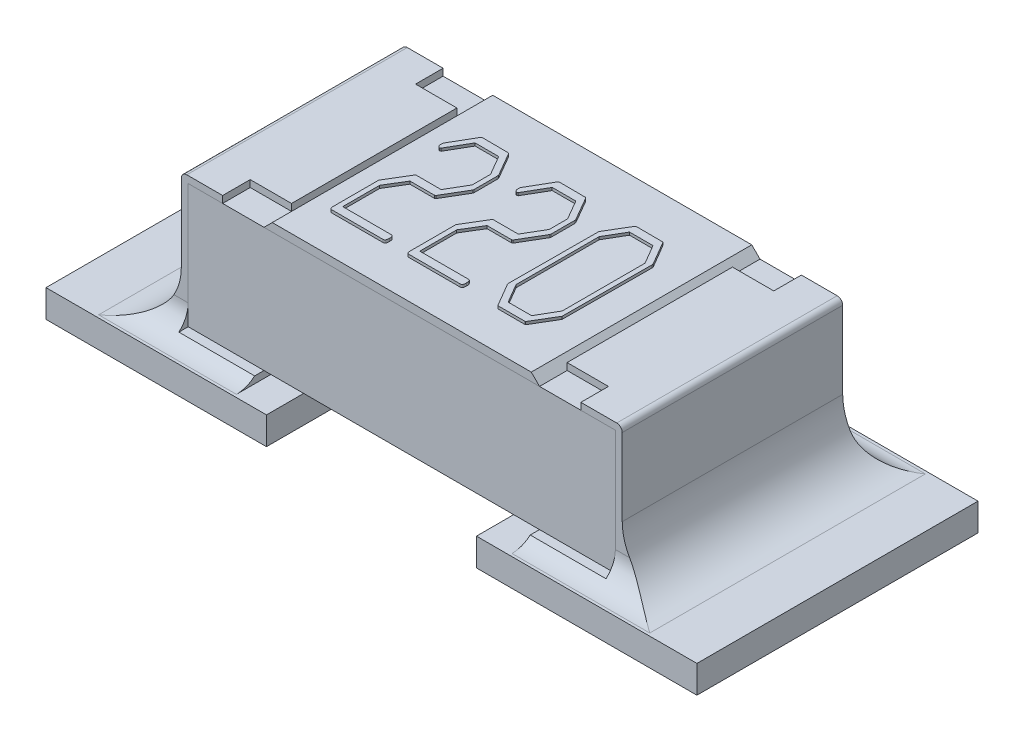
from build123d import *

# Parameters (mm, degrees)
SKETCH1_W             = 0.8
SKETCH1_H             = 0.45
BOSS_EXTRUDE1_DEPTH   = 0.775
BOSS_EXTRUDE2_DEPTH   = 0.4
BOSS_EXTRUDE2_2_DEPTH = 0.4
SKETCH3_W             = 0.15
SKETCH3_H             = 0.1
CUT_EXTRUDE1_DEPTH    = 0.025
BOSS_EXTRUDE3_DEPTH   = 0.4
BOSS_EXTRUDE4_DEPTH   = 0.01
SKETCH7_W             = 0.8
SKETCH7_H             = 1.02
BOSS_EXTRUDE5_DEPTH   = 0.1
FILLET3_R             = 0.2
FILLET4_R             = 0.2
FILLET5_R             = 0.1
FILLET6_R             = 0.1


with BuildPart() as part:
    # Sketch1 → Boss-Extrude1 (new, symmetric)
    with BuildSketch(Plane(origin=(0, 0, 0), x_dir=(0, 0, -1), z_dir=(1, 0, 0))):
        with Locations((0, 0.35)):
            Rectangle(SKETCH1_W, SKETCH1_H)
    extrude(amount=BOSS_EXTRUDE1_DEPTH, both=True)


with BuildPart() as body_2:
    # Sketch2 → Boss-Extrude2 (new, symmetric)
    with BuildSketch(Plane.XY):
        with BuildLine():
            Line((-0.5, 0.6), (-0.78, 0.6))
            ThreePointArc((-0.78, 0.6), (-0.794142136, 0.594142136), (-0.8, 0.58))
            Line((-0.8, 0.58), (-0.8, 0.1))
            Line((-0.8, 0.1), (-0.5, 0.1))
            Line((-0.5, 0.1), (-0.5, 0.125))
            Line((-0.5, 0.125), (-0.775, 0.125))
            Line((-0.775, 0.125), (-0.775, 0.575))
            Line((-0.775, 0.575), (-0.5, 0.575))
            Line((-0.5, 0.575), (-0.5, 0.6))
        make_face()
    extrude(amount=BOSS_EXTRUDE2_DEPTH, both=True)


with BuildPart() as body_3:
    # Sketch2 → Boss-Extrude2 2 (new, symmetric)
    with BuildSketch(Plane.XY):
        with BuildLine():
            Line((0.5, 0.575), (0.5, 0.6))
            Line((0.5, 0.6), (0.78, 0.6))
            ThreePointArc((0.78, 0.6), (0.794142136, 0.594142136), (0.8, 0.58))
            Line((0.8, 0.58), (0.8, 0.1))
            Line((0.8, 0.1), (0.5, 0.1))
            Line((0.5, 0.1), (0.5, 0.125))
            Line((0.5, 0.125), (0.775, 0.125))
            Line((0.775, 0.125), (0.775, 0.575))
            Line((0.775, 0.575), (0.5, 0.575))
        make_face()
    extrude(amount=BOSS_EXTRUDE2_2_DEPTH, both=True)


with BuildPart() as cut_extrude1_tool:
    # Sketch3 → Cut-Extrude1 (new body)
    with BuildSketch(Plane(origin=(0, 0.6, 0), x_dir=(1, 0, 0), z_dir=(0, 1, 0))):
        with Locations((-0.575, 0.35)):
            Rectangle(SKETCH3_W, SKETCH3_H)
        with Locations((-0.575, -0.35)):
            Rectangle(SKETCH3_W, SKETCH3_H)
        with Locations((0.575, -0.35)):
            Rectangle(SKETCH3_W, SKETCH3_H)
        with Locations((0.575, 0.35)):
            Rectangle(SKETCH3_W, SKETCH3_H)
    extrude(amount=-CUT_EXTRUDE1_DEPTH)


with BuildPart() as body_2_1:
    add(body_2.part)

    # Cut-Extrude1: cut by cut_extrude1_tool
    add(cut_extrude1_tool.part, mode=Mode.SUBTRACT)



with BuildPart() as body_3_1:
    add(body_3.part)

    # Cut-Extrude1: cut by cut_extrude1_tool
    add(cut_extrude1_tool.part, mode=Mode.SUBTRACT)


with BuildPart() as body_4:
    # Sketch4 → Boss-Extrude3 (new, symmetric)
    with BuildSketch(Plane.XY):
        Polygon((-0.5, 0.575), (0.5, 0.575), (0.47, 0.605), (-0.47, 0.605), align=None)
    extrude(amount=BOSS_EXTRUDE3_DEPTH, both=True)

    # Sketch6 → Boss-Extrude4 (add)
    # profile 1 of 3: a face of its own
    with BuildSketch(Plane(origin=(0, 0.605, 0), x_dir=(1, 0, 0), z_dir=(0, 1, 0))):
        with BuildLine():
            Line((-0.246912202, 0.234002976), (-0.198456101, 0.150204613))
            Line((-0.198456101, 0.150204613), (-0.197619048, 0.143973214))
            Line((-0.197619048, 0.143973214), (-0.197619048, 0.060918899))
            Line((-0.197619048, 0.060918899), (-0.198456101, 0.056082589))
            Line((-0.198456101, 0.056082589), (-0.247935268, -0.027715774))
            Line((-0.247935268, -0.027715774), (-0.2515625, -0.029761905))
            Line((-0.2515625, -0.029761905), (-0.340569196, -0.029761905))
            Line((-0.340569196, -0.029761905), (-0.382142857, -0.09812128))
            Line((-0.382142857, -0.09812128), (-0.382142857, -0.232142857))
            Line((-0.382142857, -0.232142857), (-0.204036458, -0.232142857))
            add(Edge.make_bspline(
                [(-0.204036458, -0.232142857), (-0.203042924, -0.232556276), (-0.200938585, -0.233431911), (-0.19880848, -0.236818481), (-0.19776471, -0.241464864), (-0.197671246, -0.245031762), (-0.197619048, -0.24702381)],
                knots=[0, 0, 0, 0, 0.727922013, 1.541763566, 2.627120282, 4, 4, 4, 4], degree=3))
            add(Edge.make_bspline(
                [(-0.197619048, -0.24702381), (-0.19766219, -0.248986973), (-0.197742135, -0.252624852), (-0.198833276, -0.256848985), (-0.200171796, -0.259656481), (-0.201882099, -0.261012244), (-0.20404098, -0.26175373), (-0.20561119, -0.261851985), (-0.206454613, -0.261904762)],
                knots=[0, 0, 0, 0, 1.783226064, 3.304443306, 3.949222629, 4.571326795, 5.232602427, 6, 6, 6, 6], degree=3))
            Line((-0.206454613, -0.261904762), (-0.394791667, -0.261904762))
            add(Edge.make_bspline(
                [(-0.394791667, -0.261904762), (-0.395997862, -0.260801207), (-0.398600433, -0.2584201), (-0.399511291, -0.254998187), (-0.4, -0.253162202)],
                knots=[0, 0, 0, 0, 0.926925341, 2, 2, 2, 2], degree=3))
            Line((-0.4, -0.253162202), (-0.4, -0.239676339))
            Line((-0.4, -0.239676339), (-0.4, -0.083519345))
            Line((-0.4, -0.083519345), (-0.350334821, -0.001302083))
            Line((-0.350334821, -0.001302083), (-0.348009673, 0))
            Line((-0.348009673, 0), (-0.257142857, 0))
            Line((-0.257142857, 0), (-0.21547619, 0.07077753))
            Line((-0.21547619, 0.07077753), (-0.21547619, 0.137555804))
            Line((-0.21547619, 0.137555804), (-0.256491815, 0.208333333))
            Line((-0.256491815, 0.208333333), (-0.342243304, 0.208333333))
            Line((-0.342243304, 0.208333333), (-0.387630208, 0.130208333))
            add(Edge.make_bspline(
                [(-0.387630208, 0.130208333), (-0.388357871, 0.129817639), (-0.389620694, 0.129139609), (-0.391031564, 0.128910385), (-0.391629464, 0.128813244)],
                knots=[0, 0, 0, 0, 1.152437574, 2, 2, 2, 2], degree=3))
            add(Edge.make_bspline(
                [(-0.391629464, 0.128813244), (-0.392807912, 0.129002619), (-0.39532525, 0.129407153), (-0.398122994, 0.132865271), (-0.399842375, 0.137855724), (-0.39994275, 0.14181055), (-0.4, 0.14406622)],
                knots=[0, 0, 0, 0, 0.723786097, 1.5461138, 2.600403721, 4, 4, 4, 4], degree=3))
            Line((-0.4, 0.14406622), (-0.399162946, 0.150297619))
            Line((-0.399162946, 0.150297619), (-0.349869792, 0.23530506))
            Line((-0.349869792, 0.23530506), (-0.346707589, 0.238095238))
            Line((-0.346707589, 0.238095238), (-0.249702381, 0.237444196))
            Line((-0.249702381, 0.237444196), (-0.246912202, 0.234002976))
        make_face()
    # profile 2 of 3: a face of its own
    with BuildSketch(Plane(origin=(0, 0.605, 0), x_dir=(1, 0, 0), z_dir=(0, 1, 0))):
        with BuildLine():
            Line((0.032849702, 0.234002976), (0.081305804, 0.150204613))
            Line((0.081305804, 0.150204613), (0.082142857, 0.143973214))
            Line((0.082142857, 0.143973214), (0.082142857, 0.060918899))
            Line((0.082142857, 0.060918899), (0.081305804, 0.056082589))
            Line((0.081305804, 0.056082589), (0.031826637, -0.027715774))
            Line((0.031826637, -0.027715774), (0.028199405, -0.029761905))
            Line((0.028199405, -0.029761905), (-0.060807292, -0.029761905))
            Line((-0.060807292, -0.029761905), (-0.102380952, -0.09812128))
            Line((-0.102380952, -0.09812128), (-0.102380952, -0.232142857))
            Line((-0.102380952, -0.232142857), (0.075725446, -0.232142857))
            add(Edge.make_bspline(
                [(0.075725446, -0.232142857), (0.076718981, -0.232556276), (0.07882332, -0.233431911), (0.080953425, -0.236818481), (0.081997194, -0.241464864), (0.082090659, -0.245031762), (0.082142857, -0.24702381)],
                knots=[0, 0, 0, 0, 0.727922013, 1.541763566, 2.627120282, 4, 4, 4, 4], degree=3))
            add(Edge.make_bspline(
                [(0.082142857, -0.24702381), (0.082099715, -0.248986973), (0.08201977, -0.252624852), (0.080928628, -0.256848985), (0.079590109, -0.259656481), (0.077879806, -0.261012244), (0.075720925, -0.26175373), (0.074150714, -0.261851985), (0.073307292, -0.261904762)],
                knots=[0, 0, 0, 0, 1.783226064, 3.304443306, 3.949222629, 4.571326795, 5.232602427, 6, 6, 6, 6], degree=3))
            Line((0.073307292, -0.261904762), (-0.115029762, -0.261904762))
            add(Edge.make_bspline(
                [(-0.115029762, -0.261904762), (-0.116235957, -0.260801207), (-0.118838528, -0.2584201), (-0.119749386, -0.254998187), (-0.120238095, -0.253162202)],
                knots=[0, 0, 0, 0, 0.926925341, 2, 2, 2, 2], degree=3))
            Line((-0.120238095, -0.253162202), (-0.120238095, -0.239676339))
            Line((-0.120238095, -0.239676339), (-0.120238095, -0.083519345))
            Line((-0.120238095, -0.083519345), (-0.070572917, -0.001302083))
            Line((-0.070572917, -0.001302083), (-0.068247768, 0))
            Line((-0.068247768, 0), (0.022619048, 0))
            Line((0.022619048, 0), (0.064285714, 0.07077753))
            Line((0.064285714, 0.07077753), (0.064285714, 0.137555804))
            Line((0.064285714, 0.137555804), (0.023270089, 0.208333333))
            Line((0.023270089, 0.208333333), (-0.062481399, 0.208333333))
            Line((-0.062481399, 0.208333333), (-0.107868304, 0.130208333))
            add(Edge.make_bspline(
                [(-0.107868304, 0.130208333), (-0.108595966, 0.129817639), (-0.109858789, 0.129139609), (-0.111269659, 0.128910385), (-0.11186756, 0.128813244)],
                knots=[0, 0, 0, 0, 1.152437574, 2, 2, 2, 2], degree=3))
            add(Edge.make_bspline(
                [(-0.11186756, 0.128813244), (-0.113046007, 0.129002619), (-0.115563345, 0.129407153), (-0.118361089, 0.132865271), (-0.120080471, 0.137855724), (-0.120180845, 0.14181055), (-0.120238095, 0.14406622)],
                knots=[0, 0, 0, 0, 0.723786097, 1.5461138, 2.600403721, 4, 4, 4, 4], degree=3))
            Line((-0.120238095, 0.14406622), (-0.119401042, 0.150297619))
            Line((-0.119401042, 0.150297619), (-0.070107887, 0.23530506))
            Line((-0.070107887, 0.23530506), (-0.066945685, 0.238095238))
            Line((-0.066945685, 0.238095238), (0.030059524, 0.237444196))
            Line((0.030059524, 0.237444196), (0.032849702, 0.234002976))
        make_face()
    # profile 3 of 3: a face of its own
    with BuildSketch(Plane(origin=(0, 0.605, 0), x_dir=(1, 0, 0), z_dir=(0, 1, 0))):
        Polygon((0.312611607, 0.234002976), (0.361067708, 0.151227679), (0.361904762, 0.145182292), (0.360323661, -0.178478423), (0.311030506, -0.26125372), (0.30703125, -0.261904762), (0.211235119, -0.261904762), (0.208816964, -0.259207589), (0.159895833, -0.17578125), (0.15952381, -0.168991815), (0.161104911, 0.154668899), (0.210398065, 0.236700149), (0.21281622, 0.238095238), (0.309821429, 0.237444196), align=None)
        Polygon((0.344047619, 0.138764881), (0.303311012, 0.208333333), (0.21811756, 0.208333333), (0.177380952, 0.138764881), (0.177380952, -0.162574405), (0.21811756, -0.232142857), (0.303311012, -0.232142857), (0.344047619, -0.161923363), align=None, mode=Mode.SUBTRACT)
    extrude(amount=BOSS_EXTRUDE4_DEPTH)


with BuildPart() as body_2_2:
    add(body_2_1.part)

    add(body_3_1.part)  # Boss-Extrude5 merges body 3
    # Sketch7 → Boss-Extrude5 (add)
    with BuildSketch(Plane(origin=(0, 0, 0), x_dir=(1, 0, 0), z_dir=(0, 1, 0))):
        with Locations((-0.781, 0)):
            Rectangle(SKETCH7_W, SKETCH7_H)
        with Locations((0.781, 0)):
            Rectangle(SKETCH7_W, SKETCH7_H)
    extrude(amount=BOSS_EXTRUDE5_DEPTH)

    # Fillet3
    fillet3_edges = [body_2_2.edges().sort_by_distance(p)[0] for p in [
        (-0.8, 0.1, 0),
    ]]
    fillet(fillet3_edges, radius=FILLET3_R)

    # Fillet4
    fillet4_edges = [body_2_2.edges().sort_by_distance(p)[0] for p in [
        (0.8, 0.1, 0),
    ]]
    fillet(fillet4_edges, radius=FILLET4_R)

    # Fillet5
    fillet5_edges = [body_2_2.edges().sort_by_distance(p)[0] for p in [
        (0.75, 0.1, 0.4),
    ]]
    fillet(fillet5_edges, radius=FILLET5_R)
    fillet5_2_edges = [body_2_2.edges().sort_by_distance(p)[0] for p in [
        (0.75, 0.1, -0.4),
    ]]
    fillet(fillet5_2_edges, radius=FILLET5_R)

    # Fillet6
    fillet6_edges = [body_2_2.edges().sort_by_distance(p)[0] for p in [
        (-0.75, 0.1, -0.4),
    ]]
    fillet(fillet6_edges, radius=FILLET6_R)
    fillet6_2_edges = [body_2_2.edges().sort_by_distance(p)[0] for p in [
        (-0.75, 0.1, 0.4),
    ]]
    fillet(fillet6_2_edges, radius=FILLET6_R)


solid = Compound([part.part, body_4.part, body_2_2.part])
